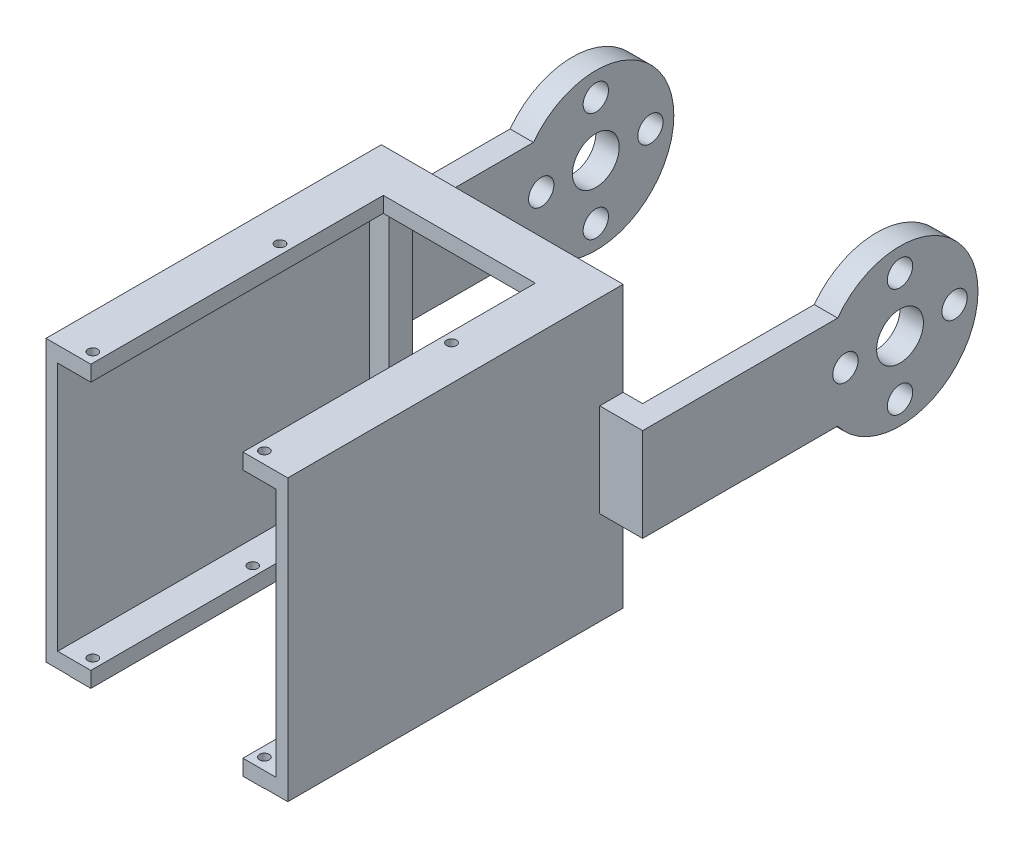
from build123d import *
from build123d.topology import SkipClean

# Parameters (mm, degrees)
BOSS_EXTRUDE1_DEPTH      = 3
SKETCH2_W                = 25
SKETCH2_H                = 2
BOSS_EXTRUDE2_DEPTH      = 40
SKETCH3_R                = 0.625
CUT_EXTRUDE1_DEPTH       = 3
SKETCH4_R                = 0.625
CUT_EXTRUDE2_DEPTH       = 3
SKETCH5_W                = 3
SKETCH5_H                = 25
BOSS_EXTRUDE3_DEPTH      = 40
SKETCH7_W                = 19.5
SKETCH7_H                = 75
CUT_EXTRUDE5_DEPTH       = 40
SKETCH10_W               = 25
SKETCH10_H               = 3
BOSS_EXTRUDE4_DEPTH      = 10
SKETCH11_W               = 25
SKETCH11_H               = 3
BOSS_EXTRUDE5_DEPTH      = 10
SKETCH12_W               = 3
SKETCH12_H               = 25
BOSS_EXTRUDE6_DEPTH      = 10
SKETCH13_W               = 3
SKETCH13_H               = 25
BOSS_EXTRUDE7_DEPTH      = 10
SKETCH14_W               = 43
SKETCH14_H               = 35.95813892
BOSS_EXTRUDE11_DEPTH     = 3
SKETCH15_W               = 43
SKETCH15_H               = 35.95813892
BOSS_EXTRUDE12_DEPTH     = 3
SKETCH16_W               = 23
SKETCH16_H               = 28
CUT_EXTRUDE6_DEPTH       = 13
CUT_EXTRUDE7_DEPTH       = 74.054773971
CUT_EXTRUDE7_DEPTH_BACK  = 74.054773971
SKETCH6_R                = 1.625
SKETCH6_R_2              = 3
FILLET1_R                = 10
FILLET2_R                = 10
SKETCH17_W               = 3
SKETCH17_H               = 2.5
CUT_EXTRUDE8_DEPTH       = 30
SKETCH19_W               = 28
SKETCH19_H               = 32
CUT_EXTRUDE9_DEPTH       = 40
CUT_EXTRUDE11_DEPTH      = 60.949979149
CUT_EXTRUDE11_DEPTH_BACK = 60.949979149
SKETCH20_W               = 25.25
SKETCH20_H               = 11.847644437
SKETCH20_W_2             = 25
SKETCH20_H_2             = 13.837487399
CUT_EXTRUDE12_DEPTH      = 70.835521048
CUT_EXTRUDE12_DEPTH_BACK = 70.835521048
CUT_EXTRUDE13_DEPTH      = 56.982140009
CUT_EXTRUDE13_DEPTH_BACK = 56.982140009
SKETCH22_W               = 10
SKETCH22_H               = 25
CUT_EXTRUDE14_DEPTH      = 10
CUT_EXTRUDE14_DEPTH_BACK = 10
SKETCH24_W               = 5.5
SKETCH24_H               = 6.5
SKETCH24_H_2             = 6.525307194


with BuildPart() as part:
    # Sketch1 → Boss-Extrude1 (new body)
    with BuildSketch(Plane.XY):
        Polygon((12.5, 12.5), (21, 12.5), (21, -12.5), (12.5, -12.5), (12.5, -18), (-12.5, -18), (-12.5, -12.5), (-21, -12.5), (-21, 12.5), (-12.5, 12.5), (-12.5, 18), (12.5, 18), align=None)
    extrude(amount=BOSS_EXTRUDE1_DEPTH)

    # Sketch2 → Boss-Extrude2 (add)
    with BuildSketch(Plane.XY.offset(3)):
        with Locations((0, 17)):
            Rectangle(SKETCH2_W, SKETCH2_H)
        with Locations((0, -17)):
            Rectangle(SKETCH2_W, SKETCH2_H)
    extrude(amount=BOSS_EXTRUDE2_DEPTH)

    # Sketch3 → Cut-Extrude1 (cut)
    with BuildSketch(Plane(origin=(0, 18, 0), x_dir=(1, 0, 0), z_dir=(0, 1, 0))):
        with Locations(Location((-11, -17.5, 0), (0, 0, 270))):
            Circle(SKETCH3_R)
        with Locations(Location((11, -17.5, 0), (0, 0, 270))):
            Circle(SKETCH3_R)
        with Locations(Location((-11, -41.5, 0), (0, 0, 270))):
            Circle(SKETCH3_R)
        with Locations(Location((11, -41.5, 0), (0, 0, 270))):
            Circle(SKETCH3_R)
    extrude(amount=-CUT_EXTRUDE1_DEPTH, mode=Mode.SUBTRACT)

    # Sketch4 → Cut-Extrude2 (cut)
    with BuildSketch(Plane(origin=(0, -16, 0), x_dir=(1, 0, 0), z_dir=(0, 1, 0))):
        with Locations(Location((-11, -41.5, 0), (0, 0, 270))):
            Circle(SKETCH4_R)
        with Locations(Location((11, -41.5, 0), (0, 0, 270))):
            Circle(SKETCH4_R)
        with Locations(Location((-11, -21, 0), (0, 0, 270))):
            Circle(SKETCH4_R)
        with Locations(Location((11, -21, 0), (0, 0, 270))):
            Circle(SKETCH4_R)
    extrude(amount=-CUT_EXTRUDE2_DEPTH, mode=Mode.SUBTRACT)

    # Sketch5 → Boss-Extrude3 (add)
    with BuildSketch(Plane(origin=(0, 0, 0), x_dir=(-1, 0, 0), z_dir=(0, 0, -1))):
        with Locations((-19.5, 0)):
            Rectangle(SKETCH5_W, SKETCH5_H)
        with Locations((19.5, 0)):
            Rectangle(SKETCH5_W, SKETCH5_H)
    extrude(amount=BOSS_EXTRUDE3_DEPTH)

    # Sketch7 → Cut-Extrude5 (cut)
    with BuildSketch(Plane(origin=(0, 18, 0), x_dir=(1, 0, 0), z_dir=(0, 1, 0))):
        with Locations((0, -43)):
            Rectangle(SKETCH7_W, SKETCH7_H)
    extrude(amount=-CUT_EXTRUDE5_DEPTH, mode=Mode.SUBTRACT)

    # Sketch10 → Boss-Extrude4 (add)
    with BuildSketch(Plane(origin=(0, 18, 0), x_dir=(1, 0, 0), z_dir=(0, 1, 0))):
        with Locations((0, -1.5)):
            Rectangle(SKETCH10_W, SKETCH10_H)
    extrude(amount=BOSS_EXTRUDE4_DEPTH)

    # Sketch11 → Boss-Extrude5 (add)
    with BuildSketch(Plane.XZ.offset(18)):
        with Locations((0, 1.5)):
            Rectangle(SKETCH11_W, SKETCH11_H)
    extrude(amount=BOSS_EXTRUDE5_DEPTH)

    # Sketch12 → Boss-Extrude6 (add)
    with BuildSketch(Plane.ZY.offset(21)):
        with Locations((1.5, 0)):
            Rectangle(SKETCH12_W, SKETCH12_H)
    extrude(amount=BOSS_EXTRUDE6_DEPTH)

    # Sketch13 → Boss-Extrude7 (add)
    with BuildSketch(Plane(origin=(21, 0, 0), x_dir=(0, 0, -1), z_dir=(1, 0, 0))):
        with Locations((-1.5, 0)):
            Rectangle(SKETCH13_W, SKETCH13_H)
    extrude(amount=BOSS_EXTRUDE7_DEPTH)

    # Sketch14 → Boss-Extrude11 (add)
    with BuildSketch(Plane.ZY.offset(12.5)):
        with Locations((21.5, 0.02093054)):
            Rectangle(SKETCH14_W, SKETCH14_H)
    extrude(amount=BOSS_EXTRUDE11_DEPTH)

    # Sketch15 → Boss-Extrude12 (add)
    with BuildSketch(Plane(origin=(12.5, 0, 0), x_dir=(0, 0, -1), z_dir=(1, 0, 0))):
        with Locations((-21.5, 0.02093054)):
            Rectangle(SKETCH15_W, SKETCH15_H)
    extrude(amount=BOSS_EXTRUDE12_DEPTH)

    # Sketch16 → Cut-Extrude6 (cut)
    with BuildSketch(Plane(origin=(0, 0, 0), x_dir=(-1, 0, 0), z_dir=(0, 0, -1))):
        Rectangle(SKETCH16_W, SKETCH16_H)
    extrude(amount=-CUT_EXTRUDE6_DEPTH, mode=Mode.SUBTRACT)

    # Sketch6 → Cut-Extrude7 (cut, two sides: drawn at the far end of the back side and taken through both)
    with BuildSketch(Plane(origin=(21, 0, 0), x_dir=(0, 0, -1), z_dir=(1, 0, 0)).offset(-CUT_EXTRUDE7_DEPTH_BACK)):
        with Locations(Location((30, 7, 0), (0, 0, 90))):
            Circle(SKETCH6_R)
        with Locations(Location((30, 0, 0), (0, 0, 90))):
            Circle(SKETCH6_R_2)
        with Locations(Location((37, 0, 0), (0, 0, 90))):
            Circle(SKETCH6_R)
        with Locations(Location((30, -7, 0), (0, 0, 90))):
            Circle(SKETCH6_R)
        with Locations(Location((23, 0, 0), (0, 0, 90))):
            Circle(SKETCH6_R)
        with BuildLine():
            Line((30, 10), (30, 12.5))
            Line((30, 12.5), (46.457343261, 12.5))
            Line((46.457343261, 12.5), (46.457343261, -12.5))
            Line((46.457343261, -12.5), (30, -12.5))
            Line((30, -12.5), (30, -10))
            ThreePointArc((30, -10), (40, 0), (30, 10))
        make_face()
    extrude(amount=CUT_EXTRUDE7_DEPTH + CUT_EXTRUDE7_DEPTH_BACK, mode=Mode.SUBTRACT)

    # Fillet1
    fillet1_edges = [part.edges().sort_by_distance(p)[0] for p in [
        (31, 12.5, 1.5),
    ]]
    fillet(fillet1_edges, radius=FILLET1_R)

    # Fillet2
    fillet2_edges = [part.edges().sort_by_distance(p)[0] for p in [
        (12.5, 28, 1.5),
        (-12.5, 28, 1.5),
        (-31, 12.5, 1.5),
        (12.5, -28, 1.5),
        (-31, -12.5, 1.5),
        (-12.5, -28, 1.5),
        (31, -12.5, 1.5),
    ]]
    fillet(fillet2_edges, radius=FILLET2_R - 0.0001)  # a hair under: the kernel refuses the full size

    # Sketch17 → Cut-Extrude8 (cut)
    with BuildSketch(Plane(origin=(0, 0, -30), x_dir=(-1, 0, 0), z_dir=(0, 0, -1))):
        with Locations((-19.5, 11.25)):
            Rectangle(SKETCH17_W, SKETCH17_H)
        with Locations((-19.5, -11.25)):
            Rectangle(SKETCH17_W, SKETCH17_H)
        with Locations((19.5, 11.25)):
            Rectangle(SKETCH17_W, SKETCH17_H)
        with Locations((19.5, -11.25)):
            Rectangle(SKETCH17_W, SKETCH17_H)
    extrude(amount=-CUT_EXTRUDE8_DEPTH, mode=Mode.SUBTRACT)

    # Sketch19 → Cut-Extrude9 (cut)
    with BuildSketch(Plane.XY.offset(43)):
        Rectangle(SKETCH19_W, SKETCH19_H)
    extrude(amount=-CUT_EXTRUDE9_DEPTH, mode=Mode.SUBTRACT)

    # Sketch20 → Cut-Extrude11 (cut, two sides: drawn at the far end of the back side and taken through both)
    with BuildSketch(Plane.XY.offset(3).offset(-CUT_EXTRUDE11_DEPTH_BACK)):
        with Locations((0, 23.923822218)):
            Rectangle(SKETCH20_W, SKETCH20_H)
        with Locations((0, -24.918743699)):
            Rectangle(SKETCH20_W_2, SKETCH20_H_2)
    extrude(amount=CUT_EXTRUDE11_DEPTH + CUT_EXTRUDE11_DEPTH_BACK, mode=Mode.SUBTRACT)

    # Sketch21 → Cut-Extrude12 (cut, two sides: drawn at the far end of the back side and taken through both)
    with SkipClean():  # the faces are left unmerged after this step: merging them gives an invalid solid
        with BuildSketch(Plane.ZY.offset(21).offset(-CUT_EXTRUDE12_DEPTH_BACK)):
            with BuildLine():
                Line((-30, 10), (0, 10))
                Line((0, 10), (0, 6))
                Line((0, 6), (-22, 6))
                ThreePointArc((-22, 6), (-25.527864045, 8.94427191), (-30, 10))
            make_face()
            with BuildLine():
                Line((-22, -6), (0, -6))
                Line((0, -6), (0, -10))
                Line((0, -10), (-30, -10))
                ThreePointArc((-30, -10), (-25.527864045, -8.94427191), (-22, -6))
            make_face()
        extrude(amount=CUT_EXTRUDE12_DEPTH + CUT_EXTRUDE12_DEPTH_BACK, mode=Mode.SUBTRACT)

    # Sketch22 → Cut-Extrude13 (cut, two sides: drawn at the far end of the back side and taken through both)
    with SkipClean():  # the faces are left unmerged after this step: merging them gives an invalid solid
        with BuildSketch(Plane(origin=(0, 0, 0), x_dir=(-1, 0, 0), z_dir=(0, 0, -1)).offset(-CUT_EXTRUDE13_DEPTH_BACK)):
            with Locations((26, 0)):
                Rectangle(SKETCH22_W, SKETCH22_H)
            with Locations((-26, 0)):
                Rectangle(SKETCH22_W, SKETCH22_H)
        extrude(amount=CUT_EXTRUDE13_DEPTH + CUT_EXTRUDE13_DEPTH_BACK, mode=Mode.SUBTRACT)

    # Sketch24 → Cut-Extrude14 (cut, two sides: drawn at the far end of the back side and taken through both)
    with SkipClean():  # the faces are left unmerged after this step: merging them gives an invalid solid
        with BuildSketch(Plane(origin=(0, 0, 0), x_dir=(-1, 0, 0), z_dir=(0, 0, -1)).offset(-CUT_EXTRUDE14_DEPTH_BACK)):
            with Locations((18.25, 9.25)):
                Rectangle(SKETCH24_W, SKETCH24_H)
            with Locations((18.25, -9.237346403)):
                Rectangle(SKETCH24_W, SKETCH24_H_2)
            with Locations((-18.25, -9.237346403)):
                Rectangle(SKETCH24_W, SKETCH24_H_2)
            with Locations((-18.25, 9.25)):
                Rectangle(SKETCH24_W, SKETCH24_H)
        extrude(amount=CUT_EXTRUDE14_DEPTH + CUT_EXTRUDE14_DEPTH_BACK, mode=Mode.SUBTRACT)


solid = part.part
